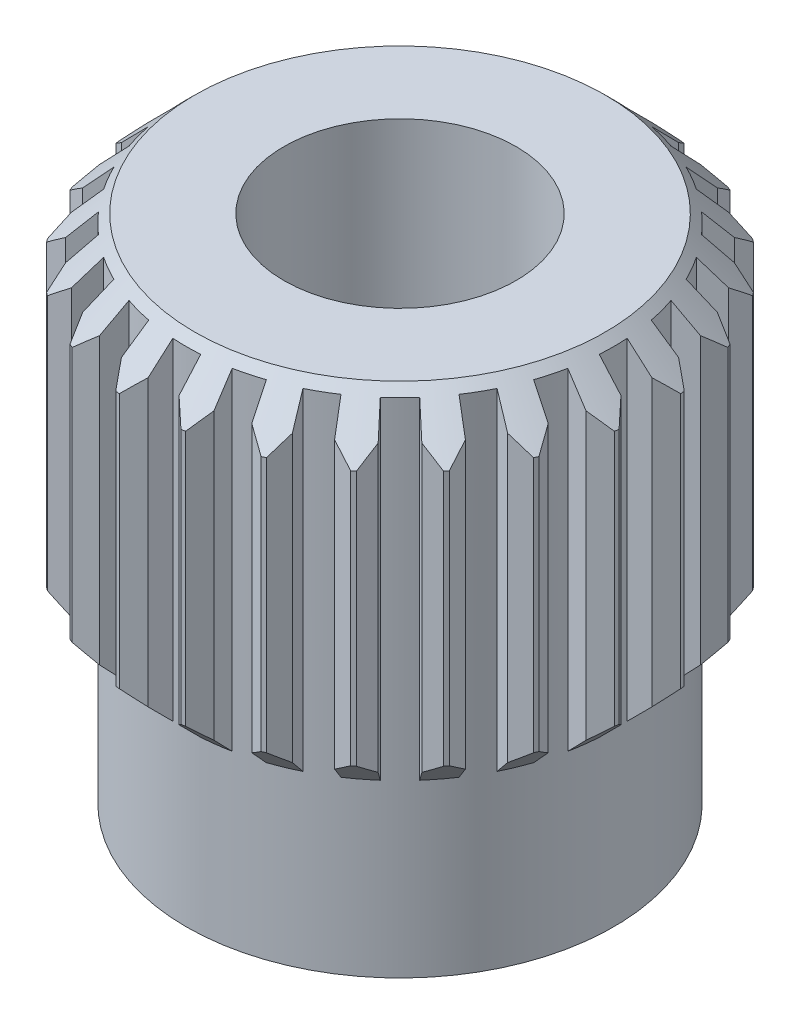
from build123d import *

# Parameters (mm, degrees)
SKETCH1_R           = 5.42
SKETCH1_R_2         = 2.5
BOSS_EXTRUDE1_DEPTH = 11
SKETCH2_OUTSIDE_W   = 16.614
SKETCH2_OUTSIDE_H   = 16.614
SKETCH2_OUTSIDE_R   = 4.6
CUT_EXTRUDE1_DEPTH  = 3.5
CHAMFER2_SIZE       = 1
CUT_EXTRUDE2_DEPTH  = 14.4071921
CIRPATTERN1_COUNT   = 24


with BuildPart() as part:
    # Sketch1 → Boss-Extrude1 (new body)
    with BuildSketch(Plane(origin=(0, 0, 0), x_dir=(1, 0, 0), z_dir=(0, 1, 0))):
        with Locations(Location((0, 0, 0), (0, 0, 270))):
            Circle(SKETCH1_R)
        with Locations(Location((0, 0, 0), (0, 0, 270))):
            Circle(SKETCH1_R_2, mode=Mode.SUBTRACT)
    extrude(amount=BOSS_EXTRUDE1_DEPTH)

    # Sketch2 outside → Cut-Extrude1 (cut)
    with BuildSketch(Plane.XZ):
        Rectangle(SKETCH2_OUTSIDE_W, SKETCH2_OUTSIDE_H)
        with Locations(Location((0, 0, 0), (0, 0, 270))):
            Circle(SKETCH2_OUTSIDE_R, mode=Mode.SUBTRACT)
    extrude(amount=-CUT_EXTRUDE1_DEPTH, mode=Mode.SUBTRACT)

    # Chamfer2
    # the kernel refuses this chamfer: 1 mm, written as the material it takes off along each edge
    with BuildSketch(Plane(origin=(0, 11, 0), x_dir=(0, 0, 1), z_dir=(-1, 0, 0))) as chamfer2_piece_1:
        Polygon((5.42, -CHAMFER2_SIZE), (5.42 - CHAMFER2_SIZE, 0), (5.42, 0), align=None)
    revolve(axis=Axis((0, 11, 0), (0, 1, 0)), mode=Mode.SUBTRACT)
    with BuildSketch(Plane(origin=(0, 3.5, 0), x_dir=(0, 0, 1), z_dir=(1, 0, 0))) as chamfer2_piece_2_section:
        Polygon((5.42, -CHAMFER2_SIZE), (5.42 - CHAMFER2_SIZE, 0), (5.42, 0), align=None)
    chamfer2_piece_2 = revolve(axis=Axis((0, 3.5, 0), (0, -1, 0)), mode=Mode.PRIVATE)
    chamfer2_piece_2 = chamfer2_piece_2 - Plane(origin=(0, 4.085992973, 0), x_dir=(0, 0, -1), z_dir=(0, -1, 0)) * Cylinder(4.6, 22, mode=Mode.PRIVATE)
    add(chamfer2_piece_2, mode=Mode.SUBTRACT)

    # Sketch3 → Cut-Extrude2 (cut, through all)
    with BuildSketch(Plane(origin=(0, 0, 0), x_dir=(1, 0, 0), z_dir=(0, 1, 0))):
        with BuildLine():
            Line((-0.3, -4.590206967), (-0.332608696, -5.089142507))
            Line((-0.332608696, -5.089142507), (-0.865289762, -5.556466699))
            Line((-0.865289762, -5.556466699), (-0.363151383, -5.556466699))
            Line((-0.363151383, -5.556466699), (-0.5, -7.650344945))
            Line((-0.5, -7.650344945), (0.5, -7.650344945))
            Line((0.5, -7.650344945), (0.363151383, -5.556466699))
            Line((0.363151383, -5.556466699), (0.865289762, -5.556466699))
            Line((0.865289762, -5.556466699), (0.332608696, -5.089142507))
            Line((0.332608696, -5.089142507), (0.3, -4.590206967))
            ThreePointArc((0.3, -4.590206967), (0, -4.6), (-0.3, -4.590206967))
        make_face()
    cut_extrude2 = extrude(amount=CUT_EXTRUDE2_DEPTH, mode=Mode.SUBTRACT)

    # CirPattern1: Cut-Extrude2 ×24 about axis
    cirpattern1_axis = Axis((0, 0, 0), (0, 1, 0))
    for i in range(1, CIRPATTERN1_COUNT):
        add(cut_extrude2.rotate(cirpattern1_axis, i * 360 / CIRPATTERN1_COUNT), mode=Mode.SUBTRACT)


solid = part.part
